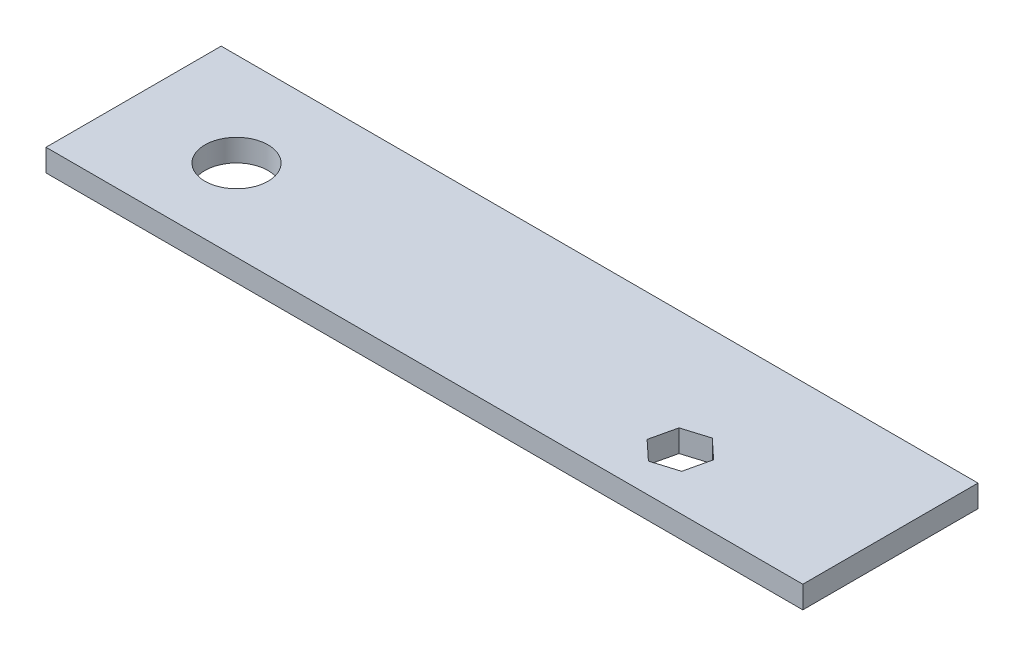
from build123d import *

# Parameters (mm, degrees)
SKETCH1_W           = 108
SKETCH1_H           = 25
SKETCH1_R           = 4.5
BOSS_EXTRUDE1_DEPTH = 3.175


with BuildPart() as part:
    # Sketch1 → Boss-Extrude1 (new body)
    with BuildSketch(Plane(origin=(0, 0, 0), x_dir=(1, 0, 0), z_dir=(0, 1, 0))):
        with Locations((54, 12.5)):
            Rectangle(SKETCH1_W, SKETCH1_H)
        with Locations((15.5424302, 11.644702803)):
            Circle(SKETCH1_R, mode=Mode.SUBTRACT)
        Polygon((86.259856293, 9.011287144), (83.479313566, 11.601966784), (79.845447821, 10.489285966), (78.992124803, 6.785925508), (81.77266753, 4.195245868), (85.406533276, 5.307926686), align=None, mode=Mode.SUBTRACT)
    extrude(amount=BOSS_EXTRUDE1_DEPTH)


solid = part.part
